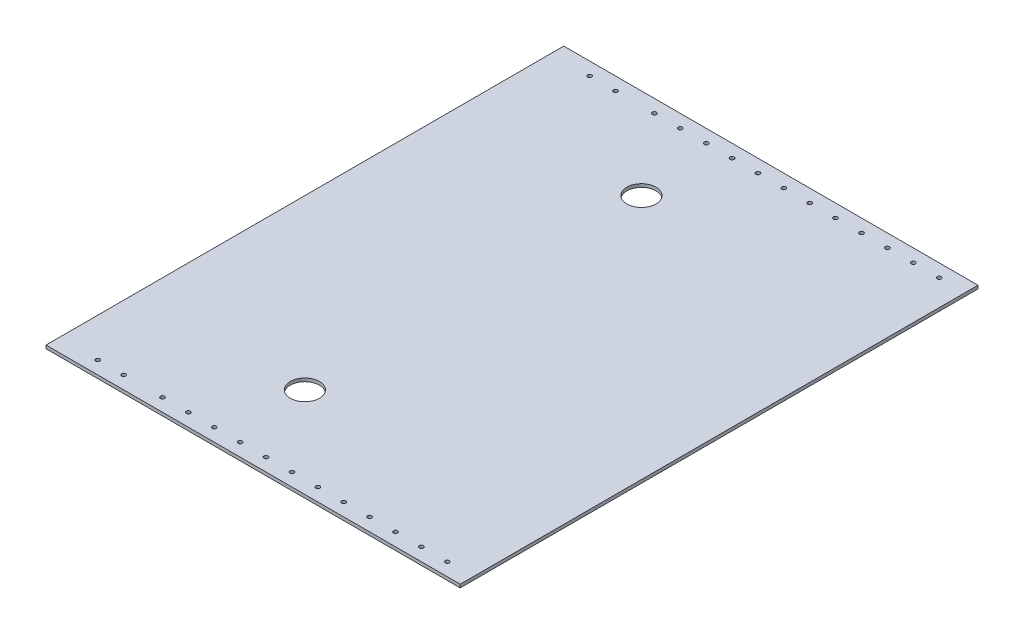
from build123d import *

# Parameters (mm, degrees)
SKETCH1_W               = 571.5
SKETCH1_H               = 508
BOSS_EXTRUDE1_DEPTH     = 3.175
SKETCH2_R               = 14.2875
CUT_EXTRUDE1_DEPTH      = 3.175
CUT_EXTRUDE3_DEPTH      = 765.64784746
CUT_EXTRUDE3_DEPTH_BACK = 765.64784746
SKETCH4_R               = 2.0193
SKETCH5_W               = 619.579537293
SKETCH5_H               = 89.035098343
CUT_EXTRUDE4_DEPTH      = 165.1


with BuildPart() as part:
    # Sketch1 → Boss-Extrude1 (new body)
    with BuildSketch(Plane(origin=(0, 0, 0), x_dir=(1, 0, 0), z_dir=(0, 1, 0))):
        with Locations((285.75, 254)):
            Rectangle(SKETCH1_W, SKETCH1_H)
    extrude(amount=BOSS_EXTRUDE1_DEPTH)

    # Sketch2 → Cut-Extrude1 (cut)
    with BuildSketch(Plane(origin=(0, 3.175, 0), x_dir=(1, 0, 0), z_dir=(0, 1, 0))):
        with Locations((330.2, 419.1)):
            Circle(SKETCH2_R)
        with Locations((330.2, 88.9)):
            Circle(SKETCH2_R)
    extrude(amount=-CUT_EXTRUDE1_DEPTH, mode=Mode.SUBTRACT)

    # Sketch4 → Cut-Extrude3 (cut, two sides: drawn at the far end of the back side and taken through both)
    with BuildSketch(Plane(origin=(0, 3.175, 0), x_dir=(1, 0, 0), z_dir=(0, 1, 0)).offset(-CUT_EXTRUDE3_DEPTH_BACK)):
        with Locations((546.1, 495.3)):
            Circle(SKETCH4_R)
        with Locations((520.7, 495.3)):
            Circle(SKETCH4_R)
        with Locations((495.3, 495.3)):
            Circle(SKETCH4_R)
        with Locations((469.9, 495.3)):
            Circle(SKETCH4_R)
        with Locations((444.5, 495.3)):
            Circle(SKETCH4_R)
        with Locations((419.1, 495.3)):
            Circle(SKETCH4_R)
        with Locations((393.7, 495.3)):
            Circle(SKETCH4_R)
        with Locations((368.3, 495.3)):
            Circle(SKETCH4_R)
        with Locations((342.9, 495.3)):
            Circle(SKETCH4_R)
        with Locations((317.5, 495.3)):
            Circle(SKETCH4_R)
        with Locations((292.1, 495.3)):
            Circle(SKETCH4_R)
        with Locations((266.7, 495.3)):
            Circle(SKETCH4_R)
        with Locations((228.6, 495.3)):
            Circle(SKETCH4_R)
        with Locations((203.2, 495.3)):
            Circle(SKETCH4_R)
        with Locations((203.2, 12.7)):
            Circle(SKETCH4_R)
        with Locations((228.6, 12.7)):
            Circle(SKETCH4_R)
        with Locations((266.7, 12.7)):
            Circle(SKETCH4_R)
        with Locations((292.1, 12.7)):
            Circle(SKETCH4_R)
        with Locations((317.5, 12.7)):
            Circle(SKETCH4_R)
        with Locations((342.9, 12.7)):
            Circle(SKETCH4_R)
        with Locations((368.3, 12.7)):
            Circle(SKETCH4_R)
        with Locations((393.7, 12.7)):
            Circle(SKETCH4_R)
        with Locations((419.1, 12.7)):
            Circle(SKETCH4_R)
        with Locations((444.5, 12.7)):
            Circle(SKETCH4_R)
        with Locations((469.9, 12.7)):
            Circle(SKETCH4_R)
        with Locations((495.3, 12.7)):
            Circle(SKETCH4_R)
        with Locations((520.7, 12.7)):
            Circle(SKETCH4_R)
        with Locations((546.1, 12.7)):
            Circle(SKETCH4_R)
    extrude(amount=CUT_EXTRUDE3_DEPTH + CUT_EXTRUDE3_DEPTH_BACK, mode=Mode.SUBTRACT)

    # Sketch5 → Cut-Extrude4 (cut)
    with BuildSketch(Plane.ZY):
        with Locations((-257.641209254, 26.710529503)):
            Rectangle(SKETCH5_W, SKETCH5_H)
    extrude(amount=-CUT_EXTRUDE4_DEPTH, mode=Mode.SUBTRACT)


solid = part.part
